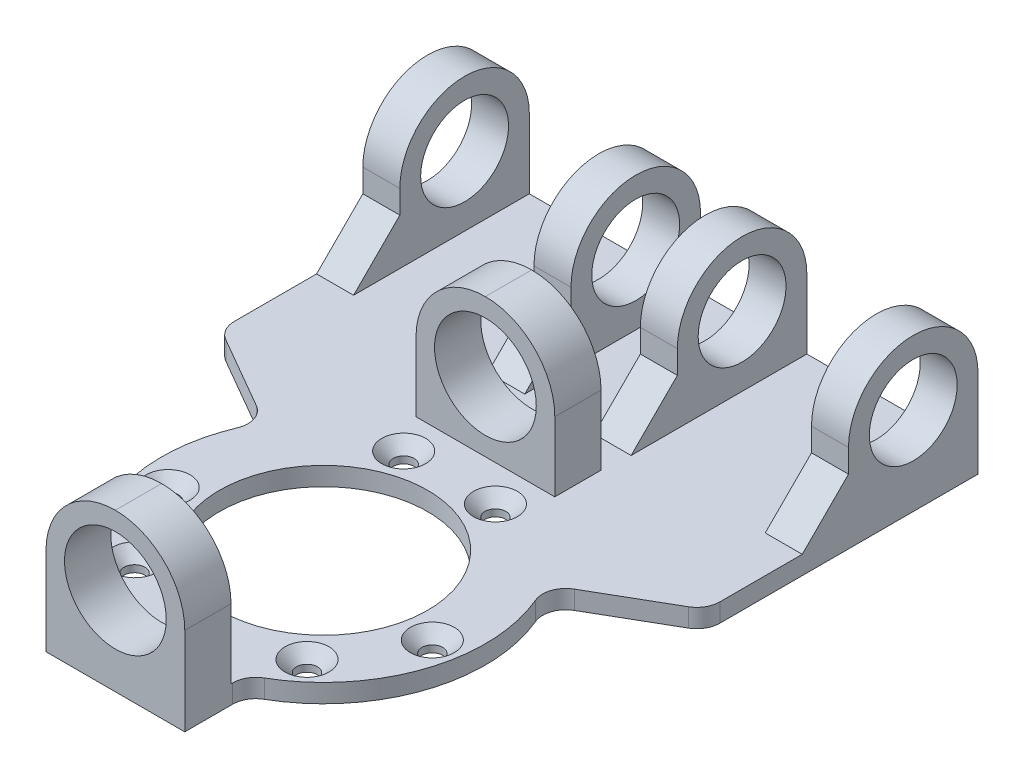
from build123d import *

# Parameters (mm, degrees)
SKETCH_1_R          = 35
SKETCH_1_R_2        = 22.5
SKETCH_1_R_3        = 2.25
EXTRUDE_1_DEPTH     = 4
EXTRUDE_2_DEPTH     = 4
SKETCH_3_W          = 30
SKETCH_3_H          = 10
EXTRUDE_3_DEPTH     = 34
EXTRUDE_4_DEPTH     = 4
SKETCH_5_R          = 9.5
EXTRUDE_5_DEPTH     = 52.5
SKETCH_6_W          = 29
SKETCH_6_H          = 29
SKETCH_6_W_2        = 15
CUT_EXTRUDE_1_DEPTH = 28
CUT_EXTRUDE_2_REACH = 149.879
SKETCH_7_R          = 11
FILLET_1_R          = 15
FILLET_3_R          = 5
CHAMFER_1_SIZE      = 2.5
CHAMFER_2_SIZE      = 10


with BuildPart() as part:
    # 草图1 → 凸台-拉伸1 (new body)
    with BuildSketch(Plane(origin=(0, 0, 0), x_dir=(1, 0, 0), z_dir=(0, 1, 0))):
        with Locations(Location((0, 0, 0), (0, 0, 270))):
            Circle(SKETCH_1_R)
        with Locations(Location((0, 0, 0), (0, 0, 270))):
            Circle(SKETCH_1_R_2, mode=Mode.SUBTRACT)
        with Locations(Location((-9.918584156, 27.251086003, 0), (0, 0, 270))):
            Circle(SKETCH_1_R_3, mode=Mode.SUBTRACT)
        with Locations(Location((9.918584156, 27.251086003, 0), (0, 0, 270))):
            Circle(SKETCH_1_R_3, mode=Mode.SUBTRACT)
        with Locations(Location((28.559424837, -5.035797152, 0), (0, 0, 270))):
            Circle(SKETCH_1_R_3, mode=Mode.SUBTRACT)
        with Locations(Location((18.640840681, -22.21528885, 0), (0, 0, 270))):
            Circle(SKETCH_1_R_3, mode=Mode.SUBTRACT)
        with Locations(Location((-18.640840681, -22.21528885, 0), (0, 0, 270))):
            Circle(SKETCH_1_R_3, mode=Mode.SUBTRACT)
        with Locations(Location((-28.559424837, -5.035797152, 0), (0, 0, 270))):
            Circle(SKETCH_1_R_3, mode=Mode.SUBTRACT)
    extrude(amount=EXTRUDE_1_DEPTH)

    # 草图2 → 凸台-拉伸2 (add)
    with BuildSketch(Plane(origin=(0, 0, 0), x_dir=(1, 0, 0), z_dir=(0, 1, 0))):
        with BuildLine():
            Line((15, -42.426406871), (15, -31.622776602))
            ThreePointArc((15, -31.622776602), (0, -35), (-15, -31.622776602))
            Line((-15, -31.622776602), (-15, -42.426406871))
            ThreePointArc((-15, -42.426406871), (0, -45), (15, -42.426406871))
        make_face()
    extrude_2 = extrude(amount=EXTRUDE_2_DEPTH)

    # 草图3 → 凸台-拉伸3 (add)
    with BuildSketch(Plane(origin=(0, 0, 0), x_dir=(1, 0, 0), z_dir=(0, 1, 0))):
        with Locations((0, -40)):
            Rectangle(SKETCH_3_W, SKETCH_3_H)
    extrude_3 = extrude(amount=EXTRUDE_3_DEPTH)

    # 镜向1: 凸台-拉伸2, 凸台-拉伸3 across plane
    add(extrude_2.mirror(Plane.XY))
    add(extrude_3.mirror(Plane.XY))

    # 草图4 → 凸台-拉伸4 (add)
    with BuildSketch(Plane(origin=(0, 0, 0), x_dir=(1, 0, 0), z_dir=(0, 1, 0))):
        with BuildLine():
            Line((-52.5, 89), (52.5, 89))
            Line((52.5, 89), (52.5, 30.310889132))
            Line((52.5, 30.310889132), (30.310889132, 17.5))
            ThreePointArc((30.310889132, 17.5), (0, 35), (-30.310889132, 17.5))
            Line((-30.310889132, 17.5), (-52.5, 30.310889132))
            Line((-52.5, 30.310889132), (-52.5, 89))
        make_face()
    extrude(amount=EXTRUDE_4_DEPTH)

    # 草图5 → 凸台-拉伸5 (add, symmetric)
    with BuildSketch(Plane(origin=(0, 0, 0), x_dir=(0, 0, -1), z_dir=(1, 0, 0))):
        with BuildLine():
            Line((89, 4), (61, 4))
            Line((61, 4), (61, 19))
            ThreePointArc((61, 19), (75, 33), (89, 19))
            Line((89, 19), (89, 4))
        make_face()
        with Locations((75, 19)):
            Circle(SKETCH_5_R, mode=Mode.SUBTRACT)
    extrude(amount=EXTRUDE_5_DEPTH, both=True)

    # 草图6 → 切除-拉伸1 (cut)
    with BuildSketch(Plane(origin=(0, 0, -89), x_dir=(-1, 0, 0), z_dir=(0, 0, -1))):
        with Locations((-30, 18.5)):
            Rectangle(SKETCH_6_W, SKETCH_6_H)
        with Locations((0, 18.5)):
            Rectangle(SKETCH_6_W_2, SKETCH_6_H)
        with Locations((30, 18.5)):
            Rectangle(SKETCH_6_W, SKETCH_6_H)
    extrude(amount=-CUT_EXTRUDE_1_DEPTH, mode=Mode.SUBTRACT)

    # 切除-拉伸2: up to this face of the body (flat: up to its plane)
    cut_extrude_2_end = Plane(part.part.faces().sort_by_distance((0, 19, -45))[0])
    # 草图7 → 切除-拉伸2 (cut, up to the picked face)
    with BuildSketch(Plane.XY.offset(45), mode=Mode.PRIVATE) as cut_extrude_2_sk1:
        with Locations((0, 19)):
            Circle(SKETCH_7_R)
    cut_extrude_2_tool1 = split(extrude(cut_extrude_2_sk1.sketch, amount=-CUT_EXTRUDE_2_REACH, mode=Mode.PRIVATE), bisect_by=cut_extrude_2_end, keep=Keep.BOTH, mode=Mode.PRIVATE)
    add(cut_extrude_2_tool1.solids().sort_by(Axis((0, 19, 45), (0, 0, -1)))[0], mode=Mode.SUBTRACT)

    # 圆角1
    fillet_1_edges = [part.edges().sort_by_distance(p)[0] for p in [
        (15, 34, -40),
        (-15, 34, -40),
        (-15, 34, 40),
        (15, 34, 40),
    ]]
    fillet(fillet_1_edges, radius=FILLET_1_R - 0.0001)  # a hair under: the kernel refuses the full size

    # 圆角3
    fillet_3_edges = [part.edges().sort_by_distance(p)[0] for p in [
        (-30.310889132, 2, -17.5),
        (30.310889132, 2, -17.5),
        (52.5, 2, -30.310889132),
        (-52.5, 2, -30.310889132),
        (15, 2, 31.622776602),
        (-15, 2, 31.622776602),
    ]]
    fillet(fillet_3_edges, radius=FILLET_3_R)

    # 倒角1
    chamfer_1_edges = [part.edges().sort_by_distance(p)[0] for p in [
        (-9.918584156, 4, -29.501086003),
        (28.559424837, 4, 2.785797152),
        (18.640840681, 4, 19.96528885),
        (-18.640840681, 4, 19.96528885),
        (-28.559424837, 4, 2.785797152),
        (9.918584156, 4, -29.501086003),
    ]]
    chamfer(chamfer_1_edges, length=CHAMFER_1_SIZE)

    # 倒角2
    chamfer_2_edges = [part.edges().sort_by_distance(p)[0] for p in [
        (48.5, 4, -61),
        (11.5, 4, -61),
        (-11.5, 4, -61),
        (-48.5, 4, -61),
    ]]
    chamfer(chamfer_2_edges, length=CHAMFER_2_SIZE)


solid = part.part
